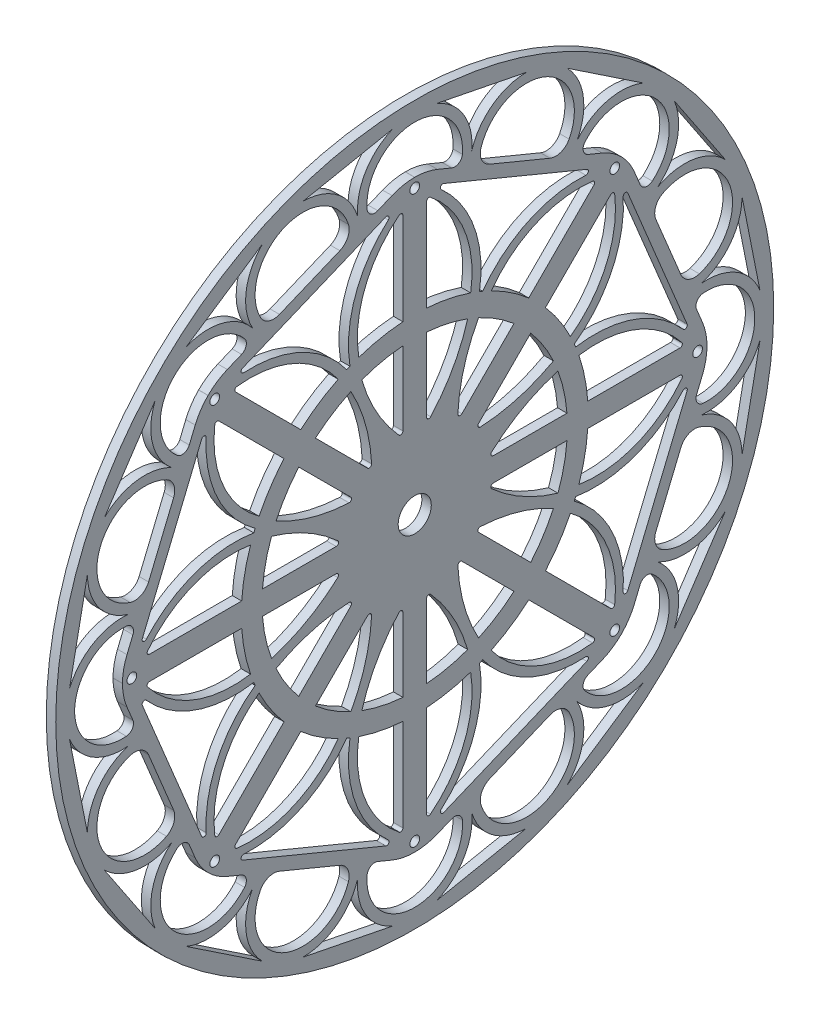
from build123d import *

# Parameters (mm, degrees)
BOSS_EXTRUDE3_DEPTH = 4
CUT_EXTRUDE5_DEPTH  = 4
CUT_EXTRUDE6_DEPTH  = 4
FILLET3_R           = 1
FILLET4_R           = 25
CIRPATTERN2_DEPTH   = 4
BOSS_EXTRUDE5_DEPTH = 4
SKETCH8_R           = 2.05
CUT_EXTRUDE7_DEPTH  = 196.804911548
CIRPATTERN4_COUNT   = 8
SKETCH9_R           = 73.34932166
SKETCH9_R_2         = 64.570140835
BOSS_EXTRUDE6_DEPTH = 4
SKETCH10_R          = 7
CUT_EXTRUDE8_DEPTH  = 10


# Read off the part's stored shape, not the designer's step: CirPattern2
with BuildPart() as part:
    # Sketch1 → Boss-Extrude3 (new body)
    with BuildSketch(Plane.YZ):
        with BuildLine():
            Line((0, 0), (-83.149157926, 83.149157926))
            ThreePointArc((-83.149157926, 83.149157926), (-85.977585051, 83.149157926), (-85.977585051, 85.977585051))
            Line((-85.977585051, 85.977585051), (-87.391798613, 87.391798613))
            Line((-87.391798613, 87.391798613), (-90.927332519, 83.856264707))
            Line((-90.927332519, 83.856264707), (-123.590666839, 5))
            Line((-123.590666839, 5), (-123.590666839, 0))
            Line((-123.590666839, 0), (-121.620081399, 0))
            ThreePointArc((-121.620081399, 0), (-119.620081399, 2), (-117.620081399, 0))
            Line((-117.620081399, 0), (0, 0))
        make_face()
    extrude(amount=BOSS_EXTRUDE3_DEPTH)

    # Sketch2 → Cut-Extrude5 (cut)
    with BuildSketch(Plane.YZ.offset(4)):
        with BuildLine():
            ThreePointArc((-64.22969944, 26.604812615), (-94.665294208, 24.445038601), (-118.178705837, 5))
            Line((-118.178705837, 5), (-87.100498195, 80.029430384))
            ThreePointArc((-87.100498195, 80.029430384), (-84.223724039, 49.653218916), (-64.22969944, 26.604812615))
        make_face()
        with BuildLine():
            ThreePointArc((-62.69896571, 30.300330745), (-80.685060609, 50.439062402), (-84.272071071, 77.201003259))
            Line((-84.272071071, 77.201003259), (-55.280693042, 48.20962523))
            Line((-55.280693042, 48.20962523), (-62.69896571, 30.300330745))
        make_face()
        with BuildLine():
            Line((-65.760433169, 22.909294485), (-73.178705837, 5))
            Line((-73.178705837, 5), (-114.178705837, 5))
            ThreePointArc((-114.178705837, 5), (-92.718756558, 21.387150435), (-65.760433169, 22.909294485))
        make_face()
    extrude(amount=-CUT_EXTRUDE5_DEPTH, mode=Mode.SUBTRACT)

    # Sketch4 → Cut-Extrude6 (cut)
    with BuildSketch(Plane.YZ.offset(4)):
        with BuildLine():
            Line((-51.453858718, 44.382790907), (-25.22623001, 18.155162198))
            ThreePointArc((-25.22623001, 18.155162198), (-42.482972176, 20.525989151), (-58.653593196, 27.001094285))
            Line((-58.653593196, 27.001094285), (-51.453858718, 44.382790907))
        make_face()
        with BuildLine():
            Line((-67.766744836, 5), (-30.675276607, 5))
            ThreePointArc((-30.675276607, 5), (-44.554063831, 15.525931591), (-60.567010358, 22.381696622))
            Line((-60.567010358, 22.381696622), (-67.766744836, 5))
        make_face()
    extrude(amount=-CUT_EXTRUDE6_DEPTH, mode=Mode.SUBTRACT)

    # Fillet3
    fillet3_edges = [part.edges().sort_by_distance(p)[0] for p in [
        (2, -114.178705837, 5),
        (2, -84.272071071, 77.201003259),
        (2, -118.178705837, 5),
        (2, -87.100498195, 80.029430384),
        (2, -30.675276607, 5),
        (2, -25.22623001, 18.155162198),
    ]]
    fillet(fillet3_edges, radius=FILLET3_R)

    # Fillet4
    fillet4_edges = [part.edges().sort_by_distance(p)[0] for p in [
        (2, -123.590666839, 5),
        (2, -90.927332519, 83.856264707),
    ]]
    fillet(fillet4_edges, radius=FILLET4_R)

    # CirPattern2 outline → CirPattern2 (add)
    with BuildSketch(Plane.YZ):
        with BuildLine():
            Line((-87.372571803, 87.411025423), (-87.391798613, 87.391798613))
            Line((-87.391798613, 87.391798613), (-85.998384286, 85.998384286))
            ThreePointArc((-85.998384286, 85.998384286), (-83.169957161, 85.998384286), (-83.169957161, 83.169957161))
            Line((-83.169957161, 83.169957161), (0, 0))
            Line((0, 0), (-117.590666839, 0))
            ThreePointArc((-117.590666839, 0), (-119.590666839, -2), (-121.590666839, 0))
            Line((-121.590666839, 0), (-123.590666839, 0))
            Line((-123.590666839, 0), (-123.590666839, -0.027190816))
            ThreePointArc((-123.590666839, -0.027190816), (-123.110298849, -4.904448866), (-121.687655152, -9.594276625))
            Line((-121.687655152, -9.594276625), (-92.830344206, -79.261988083))
            ThreePointArc((-92.830344206, -79.261988083), (-90.520096201, -83.584158099), (-87.411025423, -87.372571803))
            Line((-87.411025423, -87.372571803), (-87.372571803, -87.411025423))
            ThreePointArc((-87.372571803, -87.411025423), (-83.584158099, -90.520096201), (-79.261988083, -92.830344206))
            Line((-79.261988083, -92.830344206), (-9.594276625, -121.687655152))
            ThreePointArc((-9.594276625, -121.687655152), (-4.904448866, -123.110298849), (-0.027190816, -123.590666839))
            Line((-0.027190816, -123.590666839), (0.027190816, -123.590666839))
            ThreePointArc((0.027190816, -123.590666839), (4.904448866, -123.110298849), (9.594276625, -121.687655152))
            Line((9.594276625, -121.687655152), (79.261988083, -92.830344206))
            ThreePointArc((79.261988083, -92.830344206), (83.584158099, -90.520096201), (87.372571803, -87.411025423))
            Line((87.372571803, -87.411025423), (87.411025423, -87.372571803))
            ThreePointArc((87.411025423, -87.372571803), (90.520096201, -83.584158099), (92.830344206, -79.261988083))
            Line((92.830344206, -79.261988083), (121.687655152, -9.594276625))
            ThreePointArc((121.687655152, -9.594276625), (123.110298849, -4.904448866), (123.590666839, -0.027190816))
            Line((123.590666839, -0.027190816), (123.590666839, 0.027190816))
            ThreePointArc((123.590666839, 0.027190816), (123.110298849, 4.904448866), (121.687655152, 9.594276625))
            Line((121.687655152, 9.594276625), (92.830344206, 79.261988083))
            ThreePointArc((92.830344206, 79.261988083), (90.520096201, 83.584158099), (87.411025423, 87.372571803))
            Line((87.411025423, 87.372571803), (87.372571803, 87.411025423))
            ThreePointArc((87.372571803, 87.411025423), (83.584158099, 90.520096201), (79.261988083, 92.830344206))
            Line((79.261988083, 92.830344206), (9.594276625, 121.687655152))
            ThreePointArc((9.594276625, 121.687655152), (4.904448866, 123.110298849), (0.027190816, 123.590666839))
            Line((0.027190816, 123.590666839), (-0.027190816, 123.590666839))
            ThreePointArc((-0.027190816, 123.590666839), (-4.904448866, 123.110298849), (-9.594276625, 121.687655152))
            Line((-9.594276625, 121.687655152), (-79.261988083, 92.830344206))
            ThreePointArc((-79.261988083, 92.830344206), (-83.584158099, 90.520096201), (-87.372571803, 87.411025423))
        make_face()
        with BuildLine():
            Line((-83.169957161, -83.169957161), (-83.149157926, -83.149157926))
            ThreePointArc((-83.149157926, -83.149157926), (-83.149157926, -85.977585051), (-85.977585051, -85.977585051))
            Line((-85.977585051, -85.977585051), (-85.998384286, -85.998384286))
            ThreePointArc((-85.998384286, -85.998384286), (-85.998384286, -83.169957161), (-83.169957161, -83.169957161))
        make_face(mode=Mode.SUBTRACT)
        with BuildLine():
            ThreePointArc((-72.373701908, -88.165856998), (-46.159210034, -82.565239769), (-26.604812615, -64.22969944))
            ThreePointArc((-26.604812615, -64.22969944), (-25.742950503, -91.02193136), (-11.166739954, -113.518610751))
            ThreePointArc((-11.166739954, -113.518610751), (-10.981502806, -114.797440795), (-12.212184442, -115.191321227))
            Line((-12.212184442, -115.191321227), (-72.817245942, -90.087882806))
            ThreePointArc((-72.817245942, -90.087882806), (-73.408953748, -88.939143951), (-72.373701908, -88.165856998))
        make_face(mode=Mode.SUBTRACT)
        with BuildLine():
            Line((-75.78838816, -82.859455972), (-48.20962523, -55.280693042))
            Line((-48.20962523, -55.280693042), (-30.300330745, -62.69896571))
            ThreePointArc((-30.300330745, -62.69896571), (-49.526195584, -80.252961286), (-75.201713523, -84.559284315))
            ThreePointArc((-75.201713523, -84.559284315), (-76.026564017, -83.892815314), (-75.78838816, -82.859455972))
        make_face(mode=Mode.SUBTRACT)
        with BuildLine():
            ThreePointArc((-6.616801763, -112.96808494), (-21.727104392, -91.767721879), (-22.909294485, -65.760433169))
            Line((-22.909294485, -65.760433169), (-5, -73.178705837))
            Line((-5, -73.178705837), (-5, -112.180966406))
            ThreePointArc((-5, -112.180966406), (-5.562279634, -113.080077568), (-6.616801763, -112.96808494))
        make_face(mode=Mode.SUBTRACT)
        with BuildLine():
            ThreePointArc((-84.559284315, -75.201713523), (-80.252961286, -49.526195584), (-62.69896571, -30.300330745))
            Line((-62.69896571, -30.300330745), (-55.280693042, -48.20962523))
            Line((-55.280693042, -48.20962523), (-82.859455972, -75.78838816))
            ThreePointArc((-82.859455972, -75.78838816), (-83.892815314, -76.026564017), (-84.559284315, -75.201713523))
        make_face(mode=Mode.SUBTRACT)
        with BuildLine():
            ThreePointArc((-113.518610751, -11.166739954), (-91.02193136, -25.742950503), (-64.22969944, -26.604812615))
            ThreePointArc((-64.22969944, -26.604812615), (-82.56523977, -46.159210033), (-88.165856998, -72.373701908))
            ThreePointArc((-88.165856998, -72.373701908), (-88.939143951, -73.408953748), (-90.087882806, -72.817245942))
            Line((-90.087882806, -72.817245942), (-115.191321227, -12.212184442))
            ThreePointArc((-115.191321227, -12.212184442), (-114.797440795, -10.981502806), (-113.518610751, -11.166739954))
        make_face(mode=Mode.SUBTRACT)
        with BuildLine():
            ThreePointArc((-65.760433169, -22.909294485), (-91.767721879, -21.727104392), (-112.96808494, -6.616801763))
            ThreePointArc((-112.96808494, -6.616801763), (-113.080077568, -5.562279634), (-112.180966406, -5))
            Line((-112.180966406, -5), (-73.178705837, -5))
            Line((-73.178705837, -5), (-65.760433169, -22.909294485))
        make_face(mode=Mode.SUBTRACT)
        with BuildLine():
            Line((-27.001094285, -58.653593196), (-44.382790907, -51.453858718))
            Line((-44.382790907, -51.453858718), (-19.942927948, -27.01399576))
            ThreePointArc((-19.942927948, -27.01399576), (-18.830167575, -26.807075647), (-18.237070378, -27.771071133))
            ThreePointArc((-18.237070378, -27.771071133), (-20.862637732, -43.710786353), (-27.001094285, -58.653593196))
        make_face(mode=Mode.SUBTRACT)
        with BuildLine():
            Line((-27.01399576, -19.942927948), (-51.453858718, -44.382790907))
            Line((-51.453858718, -44.382790907), (-58.653593196, -27.001094285))
            ThreePointArc((-58.653593196, -27.001094285), (-43.710786353, -20.862637732), (-27.771071133, -18.237070378))
            ThreePointArc((-27.771071133, -18.237070378), (-26.807075647, -18.830167575), (-27.01399576, -19.942927948))
        make_face(mode=Mode.SUBTRACT)
        with BuildLine():
            Line((-5, -33.203559178), (-5, -67.766744836))
            Line((-5, -67.766744836), (-22.381696622, -60.567010358))
            ThreePointArc((-22.381696622, -60.567010358), (-16.156080828, -45.660306054), (-6.741556586, -32.532668852))
            ThreePointArc((-6.741556586, -32.532668852), (-5.640525791, -32.270404157), (-5, -33.203559178))
        make_face(mode=Mode.SUBTRACT)
        with BuildLine():
            Line((-60.567010358, -22.381696622), (-67.766744836, -5))
            Line((-67.766744836, -5), (-33.203559178, -5))
            ThreePointArc((-33.203559178, -5), (-32.270404157, -5.640525791), (-32.532668852, -6.741556586))
            ThreePointArc((-32.532668852, -6.741556586), (-45.660306054, -16.156080828), (-60.567010358, -22.381696622))
        make_face(mode=Mode.SUBTRACT)
        with BuildLine():
            Line((0, -117.620081399), (0, -117.590666839))
            ThreePointArc((0, -117.590666839), (2, -119.590666839), (0, -121.590666839))
            Line((0, -121.590666839), (0, -121.620081399))
            ThreePointArc((0, -121.620081399), (-2, -119.620081399), (0, -117.620081399))
        make_face(mode=Mode.SUBTRACT)
        with BuildLine():
            ThreePointArc((22.909294485, -65.760433169), (21.727104392, -91.767721879), (6.616801763, -112.96808494))
            ThreePointArc((6.616801763, -112.96808494), (5.562279634, -113.080077568), (5, -112.180966406))
            Line((5, -112.180966406), (5, -73.178705837))
            Line((5, -73.178705837), (22.909294485, -65.760433169))
        make_face(mode=Mode.SUBTRACT)
        with BuildLine():
            ThreePointArc((11.166739954, -113.518610751), (25.742950503, -91.02193136), (26.604812615, -64.22969944))
            ThreePointArc((26.604812615, -64.22969944), (46.159210033, -82.56523977), (72.373701908, -88.165856998))
            ThreePointArc((72.373701908, -88.165856998), (73.408953748, -88.939143951), (72.817245942, -90.087882806))
            Line((72.817245942, -90.087882806), (12.212184442, -115.191321227))
            ThreePointArc((12.212184442, -115.191321227), (10.981502806, -114.797440795), (11.166739954, -113.518610751))
        make_face(mode=Mode.SUBTRACT)
        with BuildLine():
            Line((30.300330745, -62.69896571), (48.20962523, -55.280693042))
            Line((48.20962523, -55.280693042), (75.78838816, -82.859455972))
            ThreePointArc((75.78838816, -82.859455972), (76.026564017, -83.892815314), (75.201713523, -84.559284315))
            ThreePointArc((75.201713523, -84.559284315), (49.526195584, -80.252961286), (30.300330745, -62.69896571))
        make_face(mode=Mode.SUBTRACT)
        with BuildLine():
            Line((83.169957161, -83.169957161), (83.149157926, -83.149157926))
            ThreePointArc((83.149157926, -83.149157926), (85.977585051, -83.149157926), (85.977585051, -85.977585051))
            Line((85.977585051, -85.977585051), (85.998384286, -85.998384286))
            ThreePointArc((85.998384286, -85.998384286), (83.169957161, -85.998384286), (83.169957161, -83.169957161))
        make_face(mode=Mode.SUBTRACT)
        with BuildLine():
            Line((22.381696622, -60.567010358), (5, -67.766744836))
            Line((5, -67.766744836), (5, -33.203559178))
            ThreePointArc((5, -33.203559178), (5.640525791, -32.270404157), (6.741556586, -32.532668852))
            ThreePointArc((6.741556586, -32.532668852), (16.156080828, -45.660306054), (22.381696622, -60.567010358))
        make_face(mode=Mode.SUBTRACT)
        with BuildLine():
            Line((19.942927948, -27.01399576), (44.382790907, -51.453858718))
            Line((44.382790907, -51.453858718), (27.001094285, -58.653593196))
            ThreePointArc((27.001094285, -58.653593196), (20.862637732, -43.710786353), (18.237070378, -27.771071133))
            ThreePointArc((18.237070378, -27.771071133), (18.830167575, -26.807075647), (19.942927948, -27.01399576))
        make_face(mode=Mode.SUBTRACT)
        with BuildLine():
            Line((58.653593196, -27.001094285), (51.453858718, -44.382790907))
            Line((51.453858718, -44.382790907), (27.01399576, -19.942927948))
            ThreePointArc((27.01399576, -19.942927948), (26.807075647, -18.830167575), (27.771071133, -18.237070378))
            ThreePointArc((27.771071133, -18.237070378), (43.710786353, -20.862637732), (58.653593196, -27.001094285))
        make_face(mode=Mode.SUBTRACT)
        with BuildLine():
            Line((33.203559178, -5), (67.766744836, -5))
            Line((67.766744836, -5), (60.567010358, -22.381696622))
            ThreePointArc((60.567010358, -22.381696622), (45.660306054, -16.156080828), (32.532668852, -6.741556586))
            ThreePointArc((32.532668852, -6.741556586), (32.270404157, -5.640525791), (33.203559178, -5))
        make_face(mode=Mode.SUBTRACT)
        with BuildLine():
            Line((82.859455972, -75.78838816), (55.280693042, -48.20962523))
            Line((55.280693042, -48.20962523), (62.69896571, -30.300330745))
            ThreePointArc((62.69896571, -30.300330745), (80.252961286, -49.526195584), (84.559284315, -75.201713523))
            ThreePointArc((84.559284315, -75.201713523), (83.892815314, -76.026564017), (82.859455972, -75.78838816))
        make_face(mode=Mode.SUBTRACT)
        with BuildLine():
            ThreePointArc((88.165856998, -72.373701908), (82.565239769, -46.159210034), (64.22969944, -26.604812615))
            ThreePointArc((64.22969944, -26.604812615), (91.02193136, -25.742950503), (113.518610751, -11.166739954))
            ThreePointArc((113.518610751, -11.166739954), (114.797440795, -10.981502806), (115.191321227, -12.212184442))
            Line((115.191321227, -12.212184442), (90.087882806, -72.817245942))
            ThreePointArc((90.087882806, -72.817245942), (88.939143951, -73.408953748), (88.165856998, -72.373701908))
        make_face(mode=Mode.SUBTRACT)
        with BuildLine():
            Line((65.760433169, -22.909294485), (73.178705837, -5))
            Line((73.178705837, -5), (112.180966406, -5))
            ThreePointArc((112.180966406, -5), (113.080077568, -5.562279634), (112.96808494, -6.616801763))
            ThreePointArc((112.96808494, -6.616801763), (91.767721879, -21.727104392), (65.760433169, -22.909294485))
        make_face(mode=Mode.SUBTRACT)
        with BuildLine():
            Line((-19.942927948, 27.01399576), (-44.382790907, 51.453858718))
            Line((-44.382790907, 51.453858718), (-27.001094285, 58.653593196))
            ThreePointArc((-27.001094285, 58.653593196), (-20.862637732, 43.710786353), (-18.237070378, 27.771071133))
            ThreePointArc((-18.237070378, 27.771071133), (-18.830167575, 26.807075647), (-19.942927948, 27.01399576))
        make_face(mode=Mode.SUBTRACT)
        with BuildLine():
            Line((-22.381696622, 60.567010358), (-5, 67.766744836))
            Line((-5, 67.766744836), (-5, 33.203559178))
            ThreePointArc((-5, 33.203559178), (-5.640525791, 32.270404157), (-6.741556586, 32.532668852))
            ThreePointArc((-6.741556586, 32.532668852), (-16.156080828, 45.660306054), (-22.381696622, 60.567010358))
        make_face(mode=Mode.SUBTRACT)
        with BuildLine():
            Line((-30.300330745, 62.69896571), (-48.20962523, 55.280693042))
            Line((-48.20962523, 55.280693042), (-75.78838816, 82.859455972))
            ThreePointArc((-75.78838816, 82.859455972), (-76.026564017, 83.892815314), (-75.201713523, 84.559284315))
            ThreePointArc((-75.201713523, 84.559284315), (-49.526195584, 80.252961286), (-30.300330745, 62.69896571))
        make_face(mode=Mode.SUBTRACT)
        with BuildLine():
            ThreePointArc((-11.166739954, 113.518610751), (-25.742950503, 91.02193136), (-26.604812615, 64.22969944))
            ThreePointArc((-26.604812615, 64.22969944), (-46.159210034, 82.565239769), (-72.373701908, 88.165856998))
            ThreePointArc((-72.373701908, 88.165856998), (-73.408953748, 88.939143951), (-72.817245942, 90.087882806))
            Line((-72.817245942, 90.087882806), (-12.212184442, 115.191321227))
            ThreePointArc((-12.212184442, 115.191321227), (-10.981502806, 114.797440795), (-11.166739954, 113.518610751))
        make_face(mode=Mode.SUBTRACT)
        with BuildLine():
            ThreePointArc((-6.616801763, 112.96808494), (-5.562279634, 113.080077568), (-5, 112.180966406))
            Line((-5, 112.180966406), (-5, 73.178705837))
            Line((-5, 73.178705837), (-22.909294485, 65.760433169))
            ThreePointArc((-22.909294485, 65.760433169), (-21.727104392, 91.767721879), (-6.616801763, 112.96808494))
        make_face(mode=Mode.SUBTRACT)
        with BuildLine():
            Line((60.567010358, 22.381696622), (67.766744836, 5))
            Line((67.766744836, 5), (33.203559178, 5))
            ThreePointArc((33.203559178, 5), (32.270404157, 5.640525791), (32.532668852, 6.741556586))
            ThreePointArc((32.532668852, 6.741556586), (45.660306054, 16.156080828), (60.567010358, 22.381696622))
        make_face(mode=Mode.SUBTRACT)
        with BuildLine():
            Line((5, 33.203559178), (5, 67.766744836))
            Line((5, 67.766744836), (22.381696622, 60.567010358))
            ThreePointArc((22.381696622, 60.567010358), (16.156080828, 45.660306054), (6.741556586, 32.532668852))
            ThreePointArc((6.741556586, 32.532668852), (5.640525791, 32.270404157), (5, 33.203559178))
        make_face(mode=Mode.SUBTRACT)
        with BuildLine():
            Line((27.01399576, 19.942927948), (51.453858718, 44.382790907))
            Line((51.453858718, 44.382790907), (58.653593196, 27.001094285))
            ThreePointArc((58.653593196, 27.001094285), (43.710786353, 20.862637732), (27.771071133, 18.237070378))
            ThreePointArc((27.771071133, 18.237070378), (26.807075647, 18.830167575), (27.01399576, 19.942927948))
        make_face(mode=Mode.SUBTRACT)
        with BuildLine():
            Line((27.001094285, 58.653593196), (44.382790907, 51.453858718))
            Line((44.382790907, 51.453858718), (19.942927948, 27.01399576))
            ThreePointArc((19.942927948, 27.01399576), (18.830167575, 26.807075647), (18.237070378, 27.771071133))
            ThreePointArc((18.237070378, 27.771071133), (20.862637732, 43.710786353), (27.001094285, 58.653593196))
        make_face(mode=Mode.SUBTRACT)
        with BuildLine():
            ThreePointArc((112.96808494, 6.616801763), (113.080077568, 5.562279634), (112.180966406, 5))
            Line((112.180966406, 5), (73.178705837, 5))
            Line((73.178705837, 5), (65.760433169, 22.909294485))
            ThreePointArc((65.760433169, 22.909294485), (91.767721879, 21.727104392), (112.96808494, 6.616801763))
        make_face(mode=Mode.SUBTRACT)
        with BuildLine():
            Line((121.590666839, 0), (121.620081399, 0))
            ThreePointArc((121.620081399, 0), (119.620081399, -2), (117.620081399, 0))
            Line((117.620081399, 0), (117.590666839, 0))
            ThreePointArc((117.590666839, 0), (119.590666839, 2), (121.590666839, 0))
        make_face(mode=Mode.SUBTRACT)
        with BuildLine():
            ThreePointArc((113.518610751, 11.166739954), (91.02193136, 25.742950503), (64.22969944, 26.604812615))
            ThreePointArc((64.22969944, 26.604812615), (82.56523977, 46.159210033), (88.165856998, 72.373701908))
            ThreePointArc((88.165856998, 72.373701908), (88.939143951, 73.408953748), (90.087882806, 72.817245942))
            Line((90.087882806, 72.817245942), (115.191321227, 12.212184442))
            ThreePointArc((115.191321227, 12.212184442), (114.797440795, 10.981502806), (113.518610751, 11.166739954))
        make_face(mode=Mode.SUBTRACT)
        with BuildLine():
            Line((62.69896571, 30.300330745), (55.280693042, 48.20962523))
            Line((55.280693042, 48.20962523), (82.859455972, 75.78838816))
            ThreePointArc((82.859455972, 75.78838816), (83.892815314, 76.026564017), (84.559284315, 75.201713523))
            ThreePointArc((84.559284315, 75.201713523), (80.252961286, 49.526195584), (62.69896571, 30.300330745))
        make_face(mode=Mode.SUBTRACT)
        with BuildLine():
            Line((22.909294485, 65.760433169), (5, 73.178705837))
            Line((5, 73.178705837), (5, 112.180966406))
            ThreePointArc((5, 112.180966406), (5.562279634, 113.080077568), (6.616801763, 112.96808494))
            ThreePointArc((6.616801763, 112.96808494), (21.727104392, 91.767721879), (22.909294485, 65.760433169))
        make_face(mode=Mode.SUBTRACT)
        with BuildLine():
            ThreePointArc((75.201713523, 84.559284315), (76.026564017, 83.892815314), (75.78838816, 82.859455972))
            Line((75.78838816, 82.859455972), (48.20962523, 55.280693042))
            Line((48.20962523, 55.280693042), (30.300330745, 62.69896571))
            ThreePointArc((30.300330745, 62.69896571), (49.526195584, 80.252961286), (75.201713523, 84.559284315))
        make_face(mode=Mode.SUBTRACT)
        with BuildLine():
            ThreePointArc((72.373701908, 88.165856998), (46.159210034, 82.565239769), (26.604812615, 64.22969944))
            ThreePointArc((26.604812615, 64.22969944), (25.742950503, 91.02193136), (11.166739954, 113.518610751))
            ThreePointArc((11.166739954, 113.518610751), (10.981502806, 114.797440795), (12.212184442, 115.191321227))
            Line((12.212184442, 115.191321227), (72.817245942, 90.087882806))
            ThreePointArc((72.817245942, 90.087882806), (73.408953748, 88.939143951), (72.373701908, 88.165856998))
        make_face(mode=Mode.SUBTRACT)
        with BuildLine():
            Line((0, 121.590666839), (0, 121.620081399))
            ThreePointArc((0, 121.620081399), (2, 119.620081399), (0, 117.620081399))
            Line((0, 117.620081399), (0, 117.590666839))
            ThreePointArc((0, 117.590666839), (-2, 119.590666839), (0, 121.590666839))
        make_face(mode=Mode.SUBTRACT)
        with BuildLine():
            Line((85.977585051, 85.977585051), (85.998384286, 85.998384286))
            ThreePointArc((85.998384286, 85.998384286), (85.998384286, 83.169957161), (83.169957161, 83.169957161))
            Line((83.169957161, 83.169957161), (83.149157926, 83.149157926))
            ThreePointArc((83.149157926, 83.149157926), (83.149157926, 85.977585051), (85.977585051, 85.977585051))
        make_face(mode=Mode.SUBTRACT)
    extrude(amount=CIRPATTERN2_DEPTH)

    # Sketch7 → Boss-Extrude5 (add)
    with BuildSketch(Plane.YZ.offset(4)):
        with BuildLine():
            Line((-147.818676244, 0), (-143.818676244, 0))
            ThreePointArc((-143.818676244, 0), (-137.296284825, 14.877109938), (-121.935316821, 20.160163214))
            ThreePointArc((-121.935316821, 20.160163214), (-119.410563337, 18.604158284), (-119.180378235, 15.647378563))
            Line((-119.180378235, 15.647378563), (-112.548471147, 31.658218597))
            ThreePointArc((-112.548471147, 31.658218597), (-115.751608494, 28.321107938), (-120.36850322, 28.037066564))
            ThreePointArc((-120.36850322, 28.037066564), (-132.871131375, 55.037024663), (-104.93858476, 65.288184976))
            ThreePointArc((-104.93858476, 65.288184976), (-101.874794773, 61.822699826), (-101.969528211, 57.19804611))
            Line((-101.969528211, 57.19804611), (-95.337621123, 73.208886145))
            ThreePointArc((-95.337621123, 73.208886145), (-97.591145561, 71.2808926), (-100.476677509, 71.965901272))
            ThreePointArc((-100.476677509, 71.965901272), (-107.602839353, 86.56342871), (-101.695161233, 101.695161233))
            Line((-101.695161233, 101.695161233), (-104.523588358, 104.523588358))
            Line((-104.523588358, 104.523588358), (-107.352015483, 107.352015483))
            ThreePointArc((-107.352015483, 107.352015483), (-140.262167635, 58.098492122), (-151.818676244, 0))
            Line((-151.818676244, 0), (-147.818676244, 0))
        make_face()
        with BuildLine():
            Line((-109.775560986, 96.663455519), (-131.31467441, 64.427892854))
            ThreePointArc((-131.31467441, 64.427892854), (-117.737874784, 71.261876917), (-102.761887244, 68.663295864))
            ThreePointArc((-102.761887244, 68.663295864), (-110.893725164, 81.504873426), (-109.775560986, 96.663455519))
        make_face(mode=Mode.SUBTRACT)
        with BuildLine():
            Line((-138.410896679, 47.296102897), (-145.974430877, 9.271652886))
            ThreePointArc((-145.974430877, 9.271652886), (-136.046356448, 20.78105474), (-121.215909442, 24.111345194))
            ThreePointArc((-121.215909442, 24.111345194), (-133.643007883, 32.863495699), (-138.410896679, 47.296102897))
        make_face(mode=Mode.SUBTRACT)
    boss_extrude5 = extrude(amount=-BOSS_EXTRUDE5_DEPTH)

    # Sketch8 → Cut-Extrude7 (cut, symmetric)
    with BuildSketch(Plane(origin=(4, 0, 0), x_dir=(0, 0, -1), z_dir=(1, 0, 0))):
        with Locations((-84.584170723, -84.584170723)):
            Circle(SKETCH8_R)
    cut_extrude7 = extrude(amount=CUT_EXTRUDE7_DEPTH, both=True, mode=Mode.SUBTRACT)

    # CirPattern4: Boss-Extrude5, Cut-Extrude7 ×8 about axis
    cirpattern4_axis = Axis((0, 0, 0), (1, 0, 0))
    add([boss_extrude5.rotate(cirpattern4_axis, i * 360 / CIRPATTERN4_COUNT) for i in range(1, CIRPATTERN4_COUNT)])
    add([cut_extrude7.rotate(cirpattern4_axis, i * 360 / CIRPATTERN4_COUNT) for i in range(1, CIRPATTERN4_COUNT)], mode=Mode.SUBTRACT)

    # Sketch9 → Boss-Extrude6 (add)
    with BuildSketch(Plane.ZY):
        Circle(SKETCH9_R)
        Circle(SKETCH9_R_2, mode=Mode.SUBTRACT)
    extrude(amount=-BOSS_EXTRUDE6_DEPTH)

    # Sketch10 → Cut-Extrude8 (cut)
    with BuildSketch(Plane.ZY):
        Circle(SKETCH10_R)
    extrude(amount=-CUT_EXTRUDE8_DEPTH, mode=Mode.SUBTRACT)


solid = part.part
